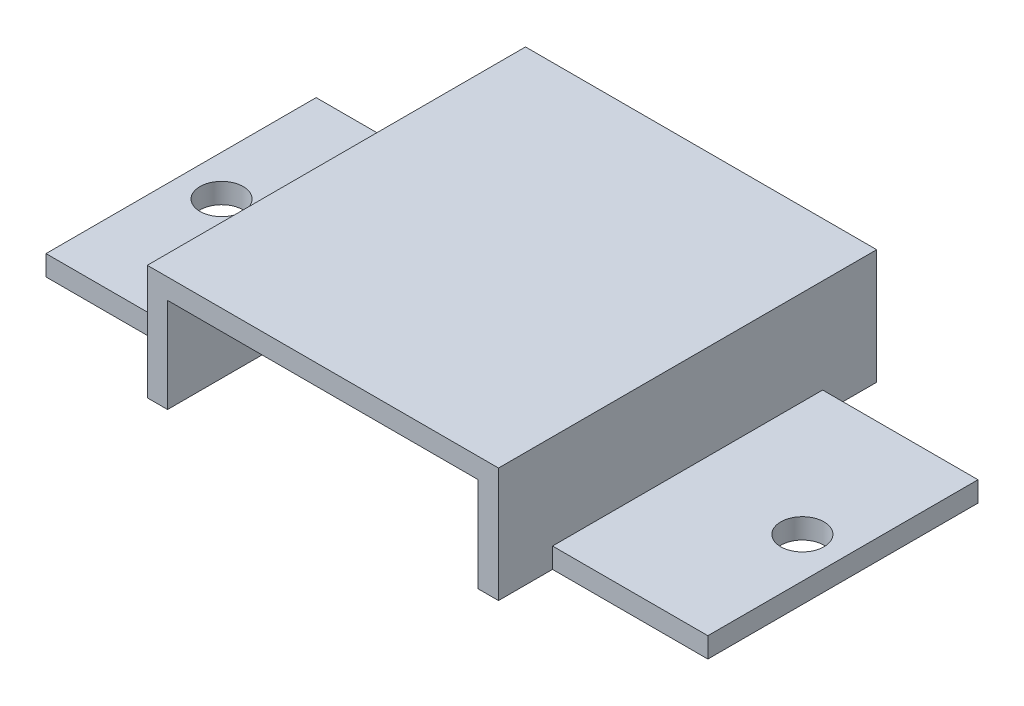
from build123d import *

# Parameters (mm, degrees)
BOSS_EXTRUDE1_DEPTH = 14
SKETCH2_W           = 11.5
SKETCH2_H           = 4
CUT_EXTRUDE1_DEPTH  = 30.470324057
SKETCH4_R           = 1.6
CUT_EXTRUDE2_DEPTH  = 30.07318352


with BuildPart() as part:
    # Sketch1 → Boss-Extrude1 (new, symmetric)
    with BuildSketch(Plane.XY):
        Polygon((-24.5, 0), (-11.5, 0), (-11.5, 7), (0, 7), (0, 8.5), (-13, 8.5), (-13, 1.5), (-24.5, 1.5), align=None)
    boss_extrude1 = extrude(amount=BOSS_EXTRUDE1_DEPTH, both=True)

    # Mirror1: Boss-Extrude1 across plane
    add(boss_extrude1.mirror(Plane(origin=(0, 0, 0), x_dir=(0, 0, 1), z_dir=(1, 0, 0))))

    # Sketch2 → Cut-Extrude1 (cut, through all)
    with BuildSketch(Plane(origin=(0, 8.5, 0), x_dir=(1, 0, 0), z_dir=(0, 1, 0))):
        with Locations((18.75, 12)):
            Rectangle(SKETCH2_W, SKETCH2_H)
        with Locations((-18.75, 12)):
            Rectangle(SKETCH2_W, SKETCH2_H)
        with Locations((18.75, -12)):
            Rectangle(SKETCH2_W, SKETCH2_H)
        with Locations((-18.75, -12)):
            Rectangle(SKETCH2_W, SKETCH2_H)
    extrude(amount=-CUT_EXTRUDE1_DEPTH, mode=Mode.SUBTRACT)

    # Sketch4 → Cut-Extrude2 (cut, through all)
    with BuildSketch(Plane(origin=(0, 1.5, 0), x_dir=(1, 0, 0), z_dir=(0, 1, 0))):
        with Locations((21.5, 0)):
            Circle(SKETCH4_R)
        with Locations((-21.5, 0)):
            Circle(SKETCH4_R)
    extrude(amount=-CUT_EXTRUDE2_DEPTH, mode=Mode.SUBTRACT)


solid = part.part
